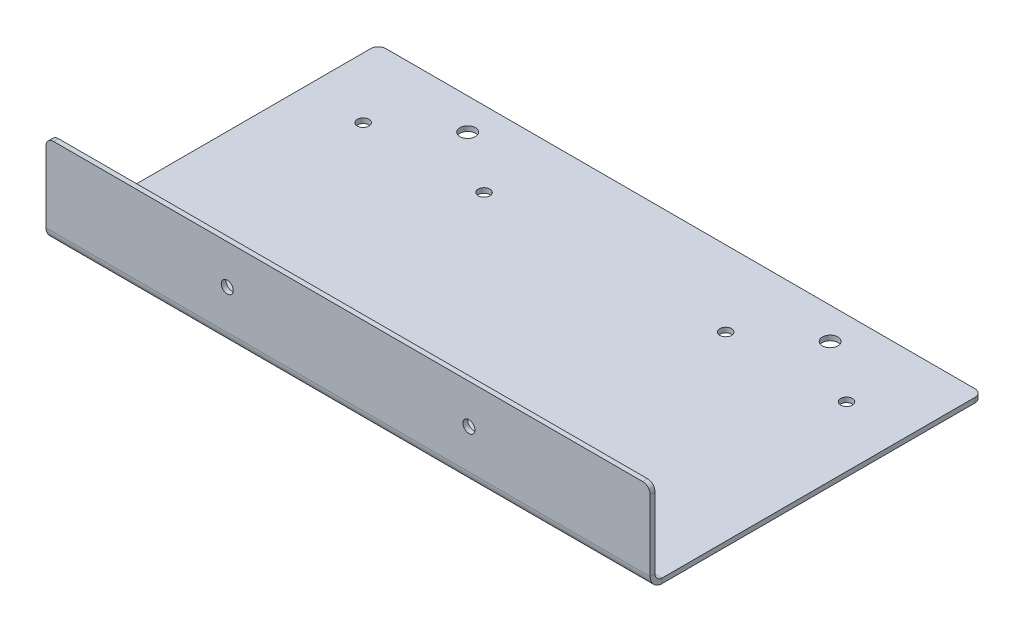
from build123d import *

# Parameters (mm, degrees)
SKETCH1_W                    = 254
SKETCH1_H                    = 139.7
BASE_FLANGE1_DEPTH           = 2.052574
EDGE_FLANGE1_STRIP_W         = 14.210296
EDGE_FLANGE1_STRIP_H         = 2.052574
EDGE_FLANGE1_STRIP_CUT_DEPTH = 254
EDGE_FLANGE1_DEPTH           = 254
F_8_0_199_DIAMETER_HOLE1_D   = 5.0546
F_10_0_1935_DIAMETER_HOLE1_D = 4.9149
F_0_257_DIAMETER_HOLE1_D     = 6.5278
FILLET1_R                    = 3.175


# Sheet-metal steps are written as plain solids
with BuildPart() as part:
    # Sketch1 → Base-Flange1 (new body)
    with BuildSketch(Plane(origin=(0, 0, 0), x_dir=(1, 0, 0), z_dir=(0, 1, 0))):
        with Locations((127, 69.85)):
            Rectangle(SKETCH1_W, SKETCH1_H)
    extrude(amount=-BASE_FLANGE1_DEPTH)

    # Edge-Flange1 strip (across the edge) → Edge-Flange1 strip cut (cut)
    with BuildSketch(Plane(origin=(0, 0, 0), x_dir=(0, 0, -1), z_dir=(1, 0, 0))):
        with Locations((-2.052574, -1.026287)):
            Rectangle(EDGE_FLANGE1_STRIP_W, EDGE_FLANGE1_STRIP_H)
    extrude(amount=EDGE_FLANGE1_STRIP_CUT_DEPTH, mode=Mode.SUBTRACT)

    # Edge-Flange1 section (across the edge) → Edge-Flange1 (add)
    with BuildSketch(Plane(origin=(0, 0, 0), x_dir=(0, 0, -1), z_dir=(1, 0, 0))):
        with BuildLine():
            Line((0, 3), (0, 36.047426))
            Line((0, 36.047426), (2.052574, 36.047426))
            Line((2.052574, 36.047426), (2.052574, 3))
            ThreePointArc((2.052574, 3), (2.931253656, 0.878679656), (5.052574, 0))
            Line((5.052574, 0), (5.052574, -2.052574))
            ThreePointArc((5.052574, -2.052574), (1.479864662, -0.572709338), (0, 3))
        make_face()
    extrude(amount=EDGE_FLANGE1_DEPTH)

    # #8 (0.199) Diameter Hole1 (through all)
    with Locations(Plane(origin=(0, 0, -2.052574), x_dir=(-1, 0, 0), z_dir=(0, 0, -1))):
        with Locations((-177.8, 19.523713), (-76.2, 19.523713)):
            Hole(F_8_0_199_DIAMETER_HOLE1_D / 2)

    # #10 (0.1935) Diameter Hole1 (through all)
    with Locations(Plane(origin=(0, 0, 0), x_dir=(1, 0, 0), z_dir=(0, 1, 0))):
        with Locations((25.4, 107.95), (76.2, 107.95), (177.8, 107.95), (228.6, 107.95)):
            Hole(F_10_0_1935_DIAMETER_HOLE1_D / 2)

    # F (0.257) Diameter Hole1 (through all)
    with Locations(Plane(origin=(0, 0, 0), x_dir=(1, 0, 0), z_dir=(0, 1, 0))):
        with Locations((203.2, 126.48184), (50.8, 126.48184)):
            Hole(F_0_257_DIAMETER_HOLE1_D / 2)

    # Fillet1
    fillet1_edges = [part.edges().sort_by_distance(p)[0] for p in [
        (0, 36.047426, -1.026287),
        (254, 36.047426, -1.026287),
        (0, -1.026287, -139.7),
        (254, -1.026287, -139.7),
    ]]
    fillet(fillet1_edges, radius=FILLET1_R)


solid = part.part
